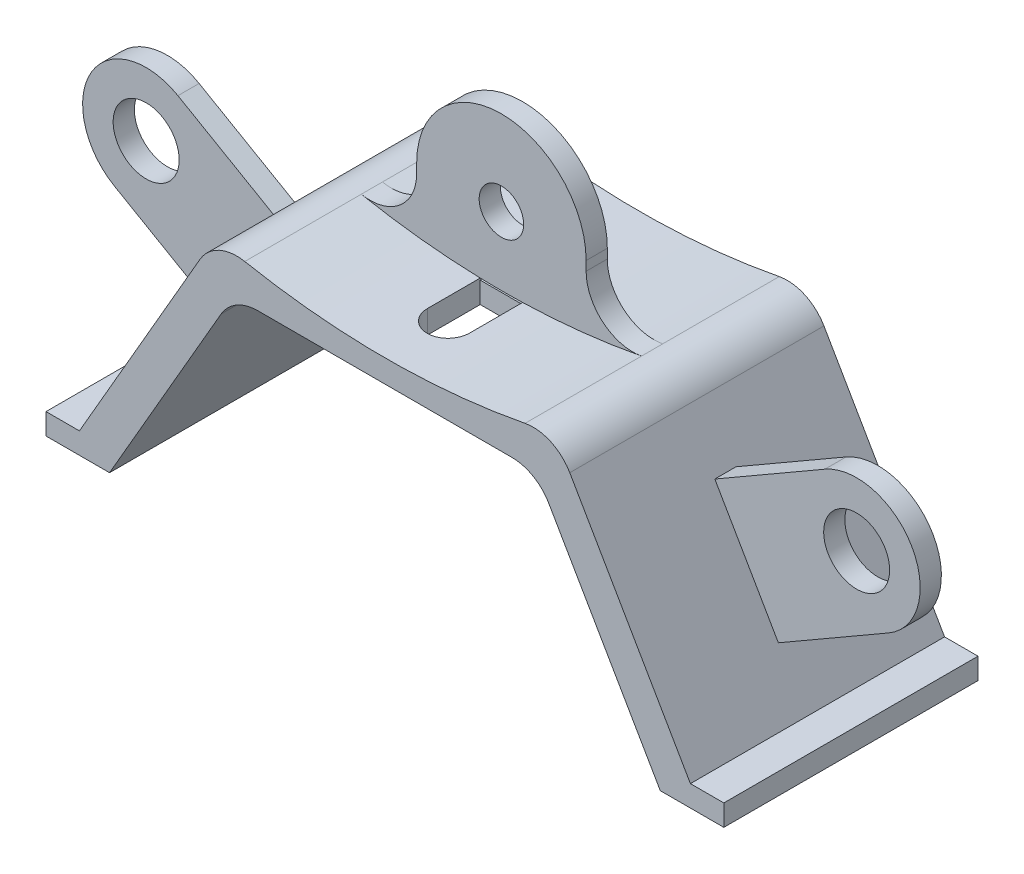
from build123d import *

# Parameters (mm, degrees)
BOSS_EXTRU_1_DEPTH      = 60
ENL_V_MAT_EXTRU_1_DEPTH = 60
CONG_1_R                = 10
ENL_V_MAT_EXTRU_2_DEPTH = 60
CONG_2_R                = 10
ESQUISSE4_W             = 15
ESQUISSE4_H             = 60
BOSS_EXTRU_2_DEPTH      = 5
BOSS_EXTRU_3_START      = -32.5
ESQUISSE5_R             = 7.789836859
ESQUISSE5_R_2           = 5.25
BOSS_EXTRU_3_DEPTH      = 5
ESQUISSE6_W             = 10
ESQUISSE6_H             = 5
BOSS_EXTRU_4_DEPTH      = 5
CONG_3_R                = 11


with BuildPart() as part:
    # Esquisse1 → Boss.-Extru.1 (new body)
    with BuildSketch(Plane.XY):
        Polygon((0, 0), (29.226497308, 50.621778265), (100.773502692, 50.621778265), (130, 0), (140, 0), (105, 60.621778265), (25, 60.621778265), (-10, 0), align=None)
    extrude(amount=BOSS_EXTRU_1_DEPTH)

    # Esquisse2 → Enlèv. mat.-Extru.1 (cut)
    with BuildSketch(Plane(origin=(0, 0, 0), x_dir=(-1, 0, 0), z_dir=(0, 0, -1))):
        with BuildLine():
            Line((-105, 60.621778265), (-25, 60.621778265))
            ThreePointArc((-25, 60.621778265), (-65, 55.979286299), (-105, 60.621778265))
        make_face()
    extrude(amount=-ENL_V_MAT_EXTRU_1_DEPTH, mode=Mode.SUBTRACT)

    # Congé1
    cong_1_edges = [part.edges().sort_by_distance(p)[0] for p in [
        (25, 60.621778265, 30),
        (105, 60.621778265, 30),
    ]]
    fillet(cong_1_edges, radius=CONG_1_R)

    # Esquisse3 → Enlèv. mat.-Extru.2 (cut)
    with BuildSketch(Plane(origin=(0, 0, 0), x_dir=(1, 0, 0), z_dir=(0, 1, 0))):
        with BuildLine():
            Line((70, -15), (70, -45))
            ThreePointArc((70, -45), (65, -50), (60, -45))
            Line((60, -45), (60, -15))
            ThreePointArc((60, -15), (65, -10), (70, -15))
        make_face()
    extrude(amount=ENL_V_MAT_EXTRU_2_DEPTH, mode=Mode.SUBTRACT)

    # Congé2
    cong_2_edges = [part.edges().sort_by_distance(p)[0] for p in [
        (100.773502692, 50.621778265, 30),
        (29.226497308, 50.621778265, 30),
    ]]
    fillet(cong_2_edges, radius=CONG_2_R)

    # Esquisse4 → Boss.-Extru.2 (add)
    with BuildSketch(Plane.XZ):
        with Locations((-7.5, 30)):
            Rectangle(ESQUISSE4_W, ESQUISSE4_H)
        with Locations((137.5, 30)):
            Rectangle(ESQUISSE4_W, ESQUISSE4_H)
    extrude(amount=-BOSS_EXTRU_2_DEPTH)

    # Esquisse5 → Boss.-Extru.3 (add)
    # profile 1 of 3: a face of its own
    with BuildSketch(Plane.XY.offset(60).offset(BOSS_EXTRU_3_START)):
        with BuildLine():
            Line((115.375109784, 42.651560984), (141.355871898, 57.651560984))
            ThreePointArc((141.355871898, 57.651560984), (161.846252955, 52.161179927), (156.355871898, 31.670798871))
            Line((156.355871898, 31.670798871), (130.375109784, 16.670798871))
            Line((130.375109784, 16.670798871), (115.375109784, 42.651560984))
        make_face()
        with Locations(Location((148.855871898, 44.661179927, 0), (0, 0, 180))):
            Circle(ESQUISSE5_R, mode=Mode.SUBTRACT)
    # profile 2 of 3: a face of its own
    with BuildSketch(Plane.XY.offset(60).offset(BOSS_EXTRU_3_START)):
        with BuildLine():
            Line((14.624890216, 42.651560984), (-0.375109784, 16.670798871))
            Line((-0.375109784, 16.670798871), (-26.355871898, 31.670798871))
            ThreePointArc((-26.355871898, 31.670798871), (-31.846252955, 52.161179927), (-11.355871898, 57.651560984))
            Line((-11.355871898, 57.651560984), (14.624890216, 42.651560984))
        make_face()
        with Locations((-18.855871898, 44.661179927)):
            Circle(ESQUISSE5_R, mode=Mode.SUBTRACT)
    # profile 3 of 3: a face of its own
    with BuildSketch(Plane.XY.offset(60).offset(BOSS_EXTRU_3_START)):
        with BuildLine():
            Line((45, 72.128262536), (45, 57.128262536))
            ThreePointArc((45, 57.128262536), (65, 55.979286299), (85, 57.128262536))
            Line((85, 57.128262536), (85, 72.128262536))
            ThreePointArc((85, 72.128262536), (65, 92.128262536), (45, 72.128262536))
        make_face()
        with Locations((65, 72.128262536)):
            Circle(ESQUISSE5_R_2, mode=Mode.SUBTRACT)
    extrude(amount=BOSS_EXTRU_3_DEPTH)

    # Esquisse6 → Boss.-Extru.4 (add)
    with BuildSketch(Plane.XZ.offset(-50.621778265)):
        with Locations((65, 30)):
            Rectangle(ESQUISSE6_W, ESQUISSE6_H)
    extrude(amount=-BOSS_EXTRU_4_DEPTH)

    # Congé3
    # the kernel refuses this fillet: 11 mm, written as the material it adds along each edge
    with BuildSketch(Plane(origin=(85, 57.128262536, 27.5), x_dir=(0.9883685049856061, 0.15207793512708467, 0), z_dir=(0, 0, 1))) as cong_3_piece_1:
        with BuildLine():
            CenterArc((12.820682636, 10.992120116), CONG_3_R, 171.25263481, 100.916203285)
            Line((1.948629081, 12.664977402), (0.861423726, 12.832263131))
            ThreePointArc((0.861423726, 12.832263131), (-0.112841396, 6.499766826), (-1.087205355, 0.167285729))
            Line((-1.087205355, 0.167285729), (-0.041678758, -1.099210117))
            ThreePointArc((-0.041678758, -1.099210117), (13.278085549, -1.099131399), (13.278598986, -1.099212012))
            Line((13.278598986, -1.099212012), (13.236970227, 0))
        make_face()
    extrude(amount=5)
    with BuildSketch(Plane(origin=(45, 57.128262536, 27.5), x_dir=(-0.9883685049856065, 0.1520779351270834, 0), z_dir=(0, 0, 1))) as cong_3_piece_2:
        with BuildLine():
            CenterArc((12.820682636, -10.992120116), CONG_3_R, 87.831161905, 100.916203285)
            Line((1.948629081, -12.664977402), (0.861423726, -12.832263131))
            ThreePointArc((0.861423726, -12.832263131), (-0.112841396, -6.499766826), (-1.087205355, -0.167285729))
            Line((-1.087205355, -0.167285729), (-0.041678758, 1.099210117))
            ThreePointArc((-0.041678758, 1.099210117), (13.278085549, 1.099131399), (13.278598986, 1.099212012))
            Line((13.278598986, 1.099212012), (13.236970227, 0))
        make_face()
    extrude(amount=5)


solid = part.part
